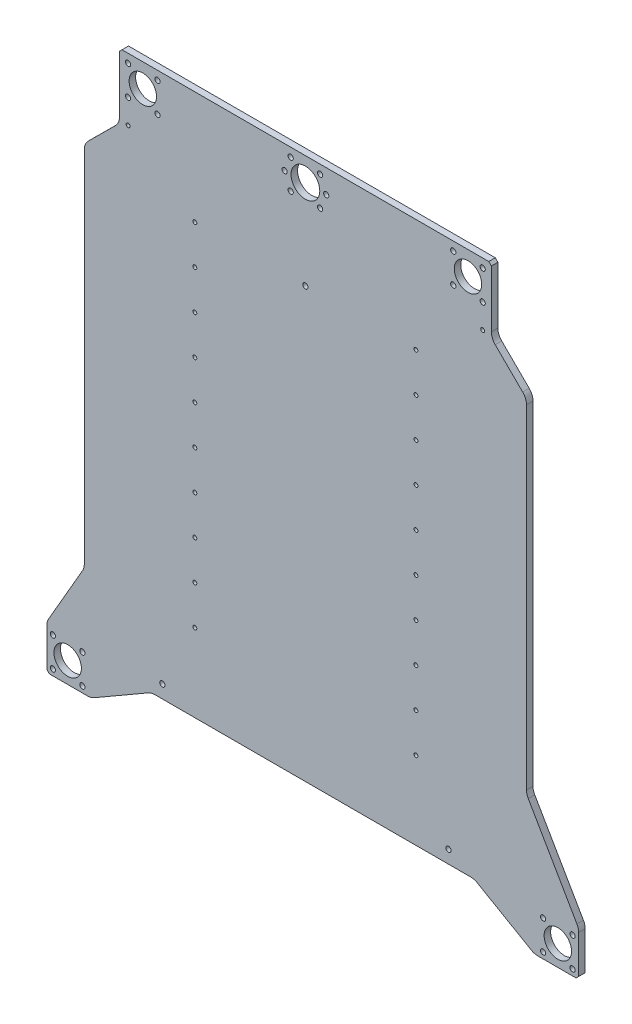
from build123d import *

# Parameters (mm, degrees)
SKETCH1_W           = 170
SKETCH1_H           = 340
BOSS_EXTRUDE1_DEPTH = 5
SKETCH2_R           = 2
CUT_EXTRUDE1_DEPTH  = 241.468293128
SKETCH3_R           = 2
SKETCH3_R_2         = 10.55
SKETCH3_R_3         = 1.5
BOSS_EXTRUDE2_DEPTH = 5
CHAMFER3_SIZE       = 5
FILLET1_R           = 10
CHAMFER2_SIZE       = 2
MIRROR2_OUTLINE_R   = 2
MIRROR2_OUTLINE_R_2 = 1.5
MIRROR2_OUTLINE_R_3 = 10.55
MIRROR2_DEPTH       = 5
SKETCH5_R           = 10.55
SKETCH5_R_2         = 2
BOSS_EXTRUDE3_DEPTH = 5
CHAMFER4_SIZE       = 2
FILLET2_R           = 10
SKETCH4_R           = 1.5
CUT_EXTRUDE2_DEPTH  = 325.156212342


# Read off the part's stored shape, not the designer's step: Mirror2
with BuildPart() as part:
    # Sketch1 → Boss-Extrude1 (new body)
    with BuildSketch(Plane.XY):
        with Locations((-85, 0)):
            Rectangle(SKETCH1_W, SKETCH1_H)
    extrude(amount=BOSS_EXTRUDE1_DEPTH)

    # Sketch2 → Cut-Extrude1 (cut, through all)
    with BuildSketch(Plane.XY.offset(5)):
        with Locations((-110, -160)):
            Circle(SKETCH2_R)
        with Locations((0, 160)):
            Circle(SKETCH2_R)
    extrude(amount=-CUT_EXTRUDE1_DEPTH, mode=Mode.SUBTRACT)

    # Sketch3 → Boss-Extrude2 (add)
    with BuildSketch(Plane.XY.offset(5)):
        with BuildLine():
            Line((-170, 170), (-143, 196.8))
            Line((-143, 196.8), (-143, 246.8))
            Line((-143, 246.8), (0, 246.8))
            Line((0, 246.8), (0, 239.85))
            ThreePointArc((0, 239.85), (-11.05, 228.8), (0, 217.75))
            Line((0, 217.75), (0, 170))
            Line((0, 170), (-170, 170))
        make_face()
        with Locations((-11.313708499, 240.113708499)):
            Circle(SKETCH3_R, mode=Mode.SUBTRACT)
        with Locations((-11.313708499, 217.486291501)):
            Circle(SKETCH3_R, mode=Mode.SUBTRACT)
        with Locations((-16, 228.8)):
            Circle(SKETCH3_R, mode=Mode.SUBTRACT)
        with Locations((-125, 228.8)):
            Circle(SKETCH3_R_2, mode=Mode.SUBTRACT)
        with Locations((-136.313708499, 240.113708499)):
            Circle(SKETCH3_R, mode=Mode.SUBTRACT)
        with Locations((-113.686291501, 240.113708499)):
            Circle(SKETCH3_R, mode=Mode.SUBTRACT)
        with Locations((-136.313708499, 217.486291501)):
            Circle(SKETCH3_R, mode=Mode.SUBTRACT)
        with Locations((-113.686291501, 217.486291501)):
            Circle(SKETCH3_R, mode=Mode.SUBTRACT)
        with Locations((-136.313708499, 198.8)):
            Circle(SKETCH3_R_3, mode=Mode.SUBTRACT)
    extrude(amount=-BOSS_EXTRUDE2_DEPTH)

    # Chamfer3
    chamfer3_edges = [part.edges().sort_by_distance(p)[0] for p in [
        (-170, -170, 2.5),
    ]]
    chamfer(chamfer3_edges, length=CHAMFER3_SIZE)

    # Fillet1
    fillet1_edges = [part.edges().sort_by_distance(p)[0] for p in [
        (-143, 196.8, 2.5),
        (-170, 170, 2.5),
    ]]
    fillet(fillet1_edges, radius=FILLET1_R)

    # Chamfer2
    chamfer2_edges = [part.edges().sort_by_distance(p)[0] for p in [
        (-143, 246.8, 2.5),
    ]]
    chamfer(chamfer2_edges, length=CHAMFER2_SIZE)

    # Mirror2 outline → Mirror2 (add)
    with BuildSketch(Plane.XY):
        with BuildLine():
            Line((0, -170), (165, -170))
            Line((165, -170), (170, -165))
            Line((170, -165), (170, 165.836071225))
            ThreePointArc((170, 165.836071225), (169.231666328, 169.680071331), (167.044732637, 172.933376494))
            Line((167.044732637, 172.933376494), (145.955267363, 193.866623506))
            ThreePointArc((145.955267363, 193.866623506), (143.768333672, 197.119928669), (143, 200.963928775))
            Line((143, 200.963928775), (143, 244.8))
            Line((143, 244.8), (141, 246.8))
            Line((141, 246.8), (0, 246.8))
            Line((0, 246.8), (0, 239.85))
            ThreePointArc((0, 239.85), (11.05, 228.8), (0, 217.75))
            Line((0, 217.75), (0, 162))
            ThreePointArc((0, 162), (2, 160), (0, 158))
            Line((0, 158), (0, -170))
        make_face()
        with Locations((110, -160)):
            Circle(MIRROR2_OUTLINE_R, mode=Mode.SUBTRACT)
        with Locations((11.313708499, 217.486291501)):
            Circle(MIRROR2_OUTLINE_R, mode=Mode.SUBTRACT)
        with Locations((11.313708499, 240.113708499)):
            Circle(MIRROR2_OUTLINE_R, mode=Mode.SUBTRACT)
        with Locations((16, 228.8)):
            Circle(MIRROR2_OUTLINE_R, mode=Mode.SUBTRACT)
        with Locations((113.686291501, 217.486291501)):
            Circle(MIRROR2_OUTLINE_R, mode=Mode.SUBTRACT)
        with Locations((113.686291501, 240.113708499)):
            Circle(MIRROR2_OUTLINE_R, mode=Mode.SUBTRACT)
        with Locations((136.313708499, 198.8)):
            Circle(MIRROR2_OUTLINE_R_2, mode=Mode.SUBTRACT)
        with Locations((136.313708499, 217.486291501)):
            Circle(MIRROR2_OUTLINE_R, mode=Mode.SUBTRACT)
        with Locations((125, 228.8)):
            Circle(MIRROR2_OUTLINE_R_3, mode=Mode.SUBTRACT)
        with Locations((136.313708499, 240.113708499)):
            Circle(MIRROR2_OUTLINE_R, mode=Mode.SUBTRACT)
    extrude(amount=MIRROR2_DEPTH)

    # Sketch5 → Boss-Extrude3 (add)
    # profile 1 of 2: a face of its own
    with BuildSketch(Plane.XY.offset(5)):
        Polygon((-198.8, -162.75), (-198.8, -196.75), (-164.8, -196.75), (-118.467640898, -170), (-170, -112.866936742), align=None)
        with Locations((-182.8, -180.75)):
            Circle(SKETCH5_R, mode=Mode.SUBTRACT)
        with Locations((-194.113708499, -169.436291501)):
            Circle(SKETCH5_R_2, mode=Mode.SUBTRACT)
        with Locations((-171.486291501, -169.436291501)):
            Circle(SKETCH5_R_2, mode=Mode.SUBTRACT)
        with Locations((-171.486291501, -192.063708499)):
            Circle(SKETCH5_R_2, mode=Mode.SUBTRACT)
        with Locations((-194.113708499, -192.063708499)):
            Circle(SKETCH5_R_2, mode=Mode.SUBTRACT)
    # profile 2 of 2: a face of its own
    with BuildSketch(Plane.XY.offset(5)):
        Polygon((176.1, -196.75), (210.1, -196.75), (210.1, -162.75), (170, -93.294762616), (129.767640898, -170), align=None)
        with Locations((194.1, -180.75)):
            Circle(SKETCH5_R, mode=Mode.SUBTRACT)
        with Locations((205.413708499, -192.063708499)):
            Circle(SKETCH5_R_2, mode=Mode.SUBTRACT)
        with Locations((205.413708499, -169.436291501)):
            Circle(SKETCH5_R_2, mode=Mode.SUBTRACT)
        with Locations((182.786291501, -169.436291501)):
            Circle(SKETCH5_R_2, mode=Mode.SUBTRACT)
        with Locations((182.786291501, -192.063708499)):
            Circle(SKETCH5_R_2, mode=Mode.SUBTRACT)
    extrude(amount=-BOSS_EXTRUDE3_DEPTH)

    # Chamfer4
    chamfer4_edges = [part.edges().sort_by_distance(p)[0] for p in [
        (-198.8, -196.75, 2.5),
        (210.1, -196.75, 2.5),
    ]]
    chamfer(chamfer4_edges, length=CHAMFER4_SIZE)

    # Fillet2
    fillet2_edges = [part.edges().sort_by_distance(p)[0] for p in [
        (-198.8, -162.75, 2.5),
        (-170, -112.866936742, 2.5),
        (-118.467640898, -170, 2.5),
        (-164.8, -196.75, 2.5),
        (176.1, -196.75, 2.5),
        (129.767640898, -170, 2.5),
        (170, -93.294762616, 2.5),
        (210.1, -162.75, 2.5),
    ]]
    fillet(fillet2_edges, radius=FILLET2_R)

    # Sketch4 → Cut-Extrude2 (cut, through all)
    with BuildSketch(Plane.XY.offset(5)):
        with Locations((-85, 160)):
            Circle(SKETCH4_R)
        with Locations((-85, 130)):
            Circle(SKETCH4_R)
        with Locations((-85, 100)):
            Circle(SKETCH4_R)
        with Locations((-85, 70)):
            Circle(SKETCH4_R)
        with Locations((-85, 40)):
            Circle(SKETCH4_R)
        with Locations((-85, 10)):
            Circle(SKETCH4_R)
        with Locations((-85, -20)):
            Circle(SKETCH4_R)
        with Locations((-85, -50)):
            Circle(SKETCH4_R)
        with Locations((-85, -80)):
            Circle(SKETCH4_R)
        with Locations((-85, -110)):
            Circle(SKETCH4_R)
    cut_extrude2 = extrude(amount=-CUT_EXTRUDE2_DEPTH, mode=Mode.SUBTRACT)

    # Mirror3: Cut-Extrude2 across plane
    add(cut_extrude2.mirror(Plane(origin=(0, 0, 0), x_dir=(0, 0, 1), z_dir=(1, 0, 0))), mode=Mode.SUBTRACT)


solid = part.part
